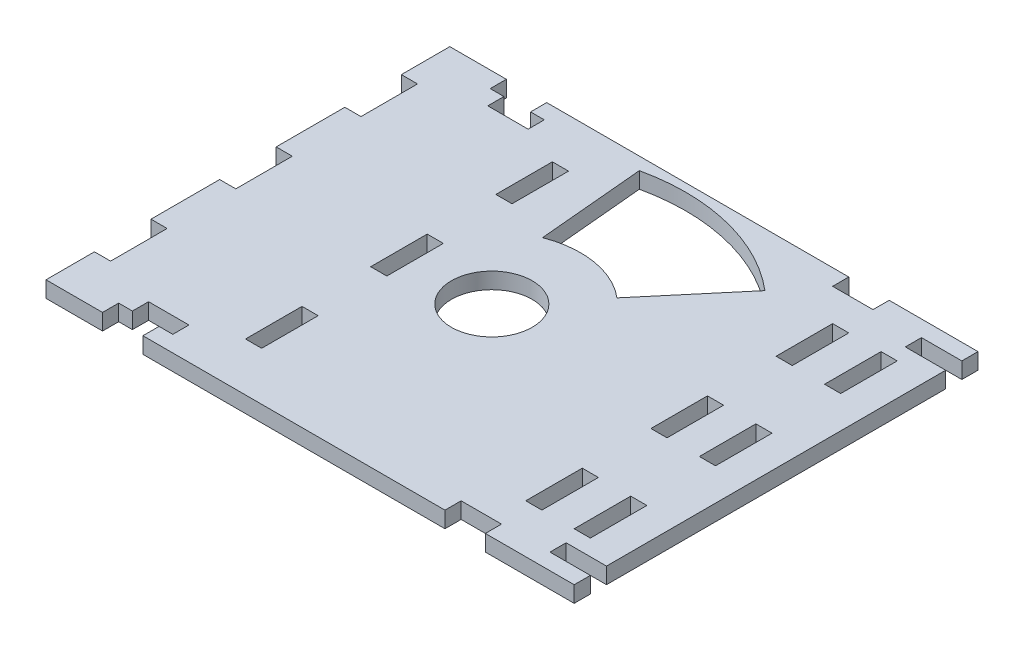
from build123d import *

# Parameters (mm, degrees)
SKETCH2_W           = 100
SKETCH2_H           = 50
SKETCH2_R           = 5
BOSS_EXTRUDE1_DEPTH = 2
SKETCH5_W           = 2
SKETCH5_H           = 7
CUT_EXTRUDE3_DEPTH  = 2
CUT_EXTRUDE6_DEPTH  = 2
SKETCH11_W          = 5
SKETCH11_H          = 2
CUT_EXTRUDE7_DEPTH  = 2
SKETCH12_W          = 6.5
SKETCH12_H          = 50
SKETCH12_W_2        = 2.8
CUT_EXTRUDE8_DEPTH  = 6
SKETCH13_W          = 12
SKETCH13_H          = 50
SKETCH13_W_2        = 2
SKETCH13_H_2        = 7
SKETCH13_W_3        = 5
SKETCH13_H_3        = 2
CUT_EXTRUDE10_DEPTH = 6


with BuildPart() as part:
    # Sketch2 → Boss-Extrude1 (new body)
    with BuildSketch(Plane(origin=(0, 0, 0), x_dir=(1, 0, 0), z_dir=(0, 1, 0))):
        Rectangle(SKETCH2_W, SKETCH2_H)
        Circle(SKETCH2_R, mode=Mode.SUBTRACT)
    extrude(amount=BOSS_EXTRUDE1_DEPTH)

    # Sketch5 → Cut-Extrude3 (cut)
    with BuildSketch(Plane(origin=(0, 0, 0), x_dir=(-1, 0, 0), z_dir=(0, -1, 0))):
        with Locations((-24.2, -15.5)):
            Rectangle(SKETCH5_W, SKETCH5_H)
        with Locations((-24.2, 0)):
            Rectangle(SKETCH5_W, SKETCH5_H)
        with Locations((-24.2, 15.5)):
            Rectangle(SKETCH5_W, SKETCH5_H)
        with Locations((10.5, 15.5)):
            Rectangle(SKETCH5_W, SKETCH5_H)
        with Locations((10.5, 0)):
            Rectangle(SKETCH5_W, SKETCH5_H)
        with Locations((10.5, -15.5)):
            Rectangle(SKETCH5_W, SKETCH5_H)
    extrude(amount=-CUT_EXTRUDE3_DEPTH, mode=Mode.SUBTRACT)

    # Sketch10 → Cut-Extrude6 (cut)
    with BuildSketch(Plane(origin=(0, 2, 0), x_dir=(1, 0, 0), z_dir=(0, 1, 0))):
        with BuildLine():
            ThreePointArc((15.473926709, 18.345506049), (5.745726742, 23.302073389), (-5.171573663, 23.436186248))
            Line((-5.171573663, 23.436186248), (-3.975341771, 10.256542195))
            ThreePointArc((-3.975341771, 10.256542195), (1.811815129, 10.849761561), (7.092216408, 8.408356939))
            Line((7.092216408, 8.408356939), (15.473926709, 18.345506049))
        make_face()
    extrude(amount=-CUT_EXTRUDE6_DEPTH, mode=Mode.SUBTRACT)

    # Sketch11 → Cut-Extrude7 (cut)
    with BuildSketch(Plane(origin=(0, 2, 0), x_dir=(1, 0, 0), z_dir=(0, 1, 0))):
        with Locations((-19, -22)):
            Rectangle(SKETCH11_W, SKETCH11_H)
        with Locations((32.7, -22)):
            Rectangle(SKETCH11_W, SKETCH11_H)
        with Locations((32.7, 22)):
            Rectangle(SKETCH11_W, SKETCH11_H)
        with Locations((-19, 22)):
            Rectangle(SKETCH11_W, SKETCH11_H)
    extrude(amount=-CUT_EXTRUDE7_DEPTH, mode=Mode.SUBTRACT)

    # Sketch12 → Cut-Extrude8 (cut)
    with BuildSketch(Plane(origin=(0, 2, 0), x_dir=(1, 0, 0), z_dir=(0, 1, 0))):
        with Locations((-46.75, 0)):
            Rectangle(SKETCH12_W, SKETCH12_H)
        with Locations((48.6, 0)):
            Rectangle(SKETCH12_W_2, SKETCH12_H)
    extrude(amount=-CUT_EXTRUDE8_DEPTH, mode=Mode.SUBTRACT)

    # Sketch13 → Cut-Extrude10 (cut)
    with BuildSketch(Plane(origin=(0, 2, 0), x_dir=(1, 0, 0), z_dir=(0, 1, 0))):
        with Locations((41.2, 0)):
            Rectangle(SKETCH13_W, SKETCH13_H)
        with Locations((30.2, 15.5)):
            Rectangle(SKETCH13_W_2, SKETCH13_H_2)
        with Locations((21.7, 24)):
            Rectangle(SKETCH13_W_3, SKETCH13_H_3)
        with Locations((30.2, 0)):
            Rectangle(SKETCH13_W_2, SKETCH13_H_2)
        with Locations((-20.7, 24)):
            Rectangle(SKETCH13_W_3, SKETCH13_H_3)
        with Locations((30.2, -15.5)):
            Rectangle(SKETCH13_W_2, SKETCH13_H_2)
        with Locations((21.7, -24)):
            Rectangle(SKETCH13_W_3, SKETCH13_H_3)
        Polygon((-30.2, 19), (-30.2, 25), (-43.5, 25), (-43.5, -25), (-30.2, -25), (-30.2, -19), (-28.2, -19), (-28.2, -12), (-30.2, -12), (-30.2, -3.5), (-28.2, -3.5), (-28.2, 3.5), (-30.2, 3.5), (-30.2, 12), (-28.2, 12), (-28.2, 19), align=None)
        with Locations((-20.7, -24)):
            Rectangle(SKETCH13_W_3, SKETCH13_H_3)
    extrude(amount=-CUT_EXTRUDE10_DEPTH, mode=Mode.SUBTRACT)


solid = part.part
